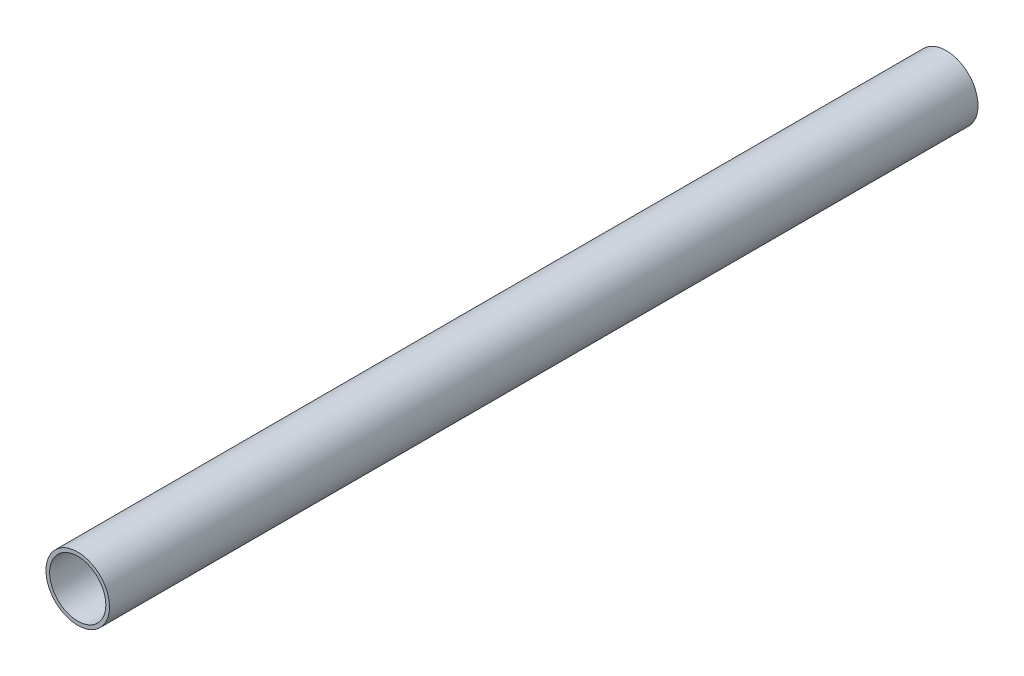
from build123d import *

# Parameters (mm, degrees)
SKETCH1_R           = 6.5
SKETCH1_R_2         = 5.75
BOSS_EXTRUDE1_DEPTH = 177.65014


with BuildPart() as part:
    # Sketch1 → Boss-Extrude1 (new body)
    with BuildSketch(Plane.XY):
        Circle(SKETCH1_R)
        Circle(SKETCH1_R_2, mode=Mode.SUBTRACT)
    extrude(amount=BOSS_EXTRUDE1_DEPTH)


solid = part.part
